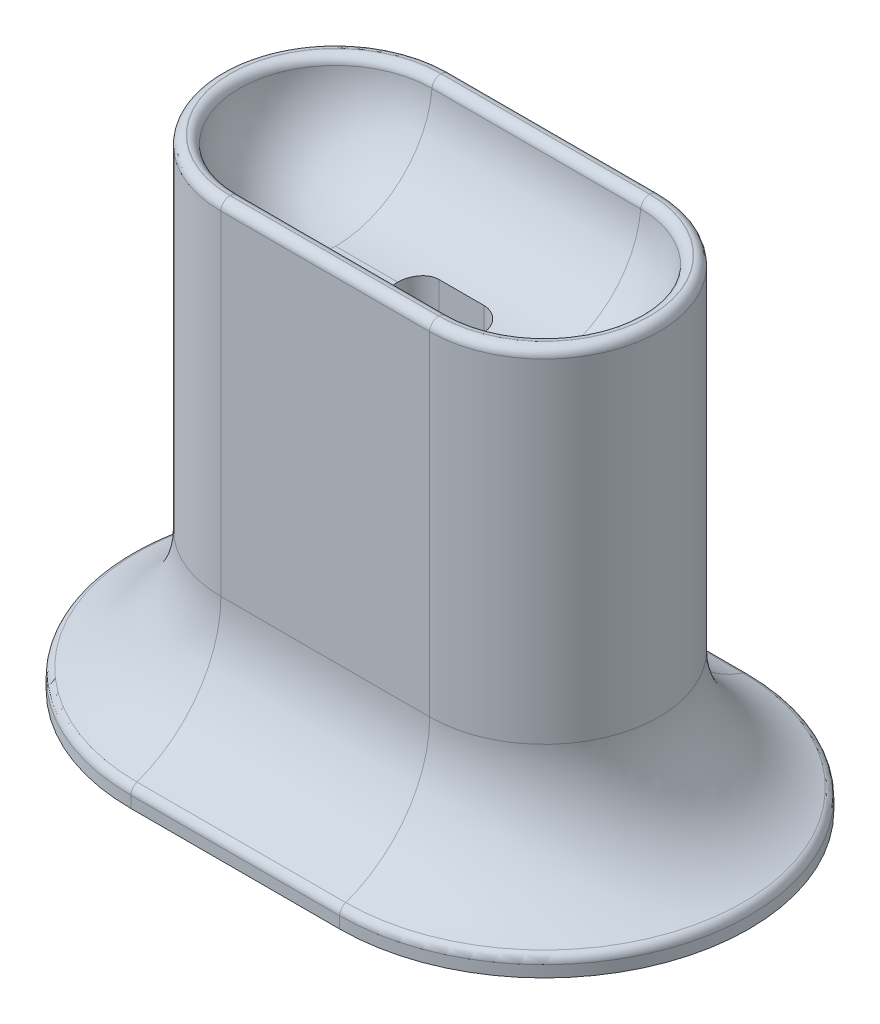
from build123d import *

# Parameters (mm, degrees)
BOSS_EXTRUDE1_DEPTH     = 53.5
BOSS_EXTRUDE2_START     = 32.75
BOSS_EXTRUDE2_DEPTH     = 10
BOSS_EXTRUDE3_DEPTH     = 2
FILLET1_R               = 10.75
FILLET2_R               = 14
FILLET3_R               = 1
CUT_EXTRUDE4_DEPTH      = 79.076260797
CUT_EXTRUDE5_DEPTH      = 61.840180017
CUT_EXTRUDE5_DEPTH_BACK = 61.840180017


# Some blends are built 0.0001 mm under size
with BuildPart() as part:
    # Sketch2 → Boss-Extrude1 (new body)
    with BuildSketch(Plane(origin=(0, 0, 0), x_dir=(1, 0, 0), z_dir=(0, 1, 0))):
        with BuildLine():
            Line((0, -12.75), (23.2, -12.75))
            ThreePointArc((23.2, -12.75), (35.95, 0), (23.2, 12.75))
            Line((23.2, 12.75), (0, 12.75))
            ThreePointArc((0, 12.75), (-12.75, 0), (0, -12.75))
        make_face()
        with BuildLine():
            ThreePointArc((23.2, -10.75), (33.95, 0), (23.2, 10.75))
            Line((23.2, 10.75), (0, 10.75))
            ThreePointArc((0, 10.75), (-10.75, 0), (0, -10.75))
            Line((0, -10.75), (23.2, -10.75))
        make_face(mode=Mode.SUBTRACT)
    extrude(amount=BOSS_EXTRUDE1_DEPTH)

    # Sketch2<3> → Boss-Extrude2 (add)
    with BuildSketch(Plane(origin=(0, 0, 0), x_dir=(1, 0, 0), z_dir=(0, 1, 0)).offset(BOSS_EXTRUDE2_START)):
        with BuildLine():
            Line((0, -10.75), (23.2, -10.75))
            ThreePointArc((23.2, -10.75), (33.95, 0), (23.2, 10.75))
            Line((23.2, 10.75), (0, 10.75))
            ThreePointArc((0, 10.75), (-10.75, 0), (0, -10.75))
        make_face()
    extrude(amount=BOSS_EXTRUDE2_DEPTH)

    # Sketch2<4> → Boss-Extrude3 (add)
    with BuildSketch(Plane(origin=(0, 0, 0), x_dir=(1, 0, 0), z_dir=(0, 1, 0))):
        with BuildLine():
            Line((0, 22.75), (23.2, 22.75))
            ThreePointArc((23.2, 22.75), (45.95, 0), (23.2, -22.75))
            Line((23.2, -22.75), (0, -22.75))
            ThreePointArc((0, -22.75), (-22.75, 0), (0, 22.75))
        make_face()
        with BuildLine():
            ThreePointArc((23.2, -12.75), (35.95, 0), (23.2, 12.75))
            Line((23.2, 12.75), (0, 12.75))
            ThreePointArc((0, 12.75), (-12.75, 0), (0, -12.75))
            Line((0, -12.75), (23.2, -12.75))
        make_face(mode=Mode.SUBTRACT)
    extrude(amount=BOSS_EXTRUDE3_DEPTH)

    # Fillet1
    fillet1_edges = [part.edges().sort_by_distance(p)[0] for p in [
        (11.6, 42.75, -10.75),
        (33.95, 42.75, 0),
        (11.6, 42.75, 10.75),
        (-10.75, 42.75, 0),
    ]]
    fillet(fillet1_edges, radius=FILLET1_R - 0.0001)  # a hair under: the kernel refuses the full size

    # Fillet2
    # the kernel refuses this fillet: 14 mm, written as the material it adds along each edge
    with BuildSketch(Plane(origin=(23.2, 2, 0), x_dir=(0, 0, 1), z_dir=(-1, 0, 0))) as fillet2_piece_1:
        with BuildLine():
            CenterArc((26.75, 13.416407865), FILLET2_R, 180, 73.398450401)
            Line((22.75, 0), (22.67, -0.268328157))
            ThreePointArc((22.67, -0.268328157), (17.75, -0.28), (12.75, -0.28))
            Line((12.75, -0.28), (12.47, 0))
            Line((12.47, 0), (12.47, 13.416407865))
            Line((12.47, 13.416407865), (12.75, 13.416407865))
        make_face()
    revolve(axis=Axis((23.2, 2, 0), (0, 1, 0)), revolution_arc=180)
    with BuildSketch(Plane(origin=(0, 2, 12.75), x_dir=(0, 1, 0), z_dir=(1, 0, 0)), Plane(origin=(23.2, 2, -12.75), x_dir=(0, 1, 0), z_dir=(-1, 0, 0))) as fillet2_piece_2:
        with BuildLine():
            CenterArc((13.416407865, 14), FILLET2_R, 196.601549599, 73.398450401)
            Line((0, 10), (-0.268328157, 9.92))
            ThreePointArc((-0.268328157, 9.92), (-0.28, 5), (-0.28, 0))
            Line((-0.28, 0), (0, -0.28))
            Line((0, -0.28), (13.416407865, -0.28))
            Line((13.416407865, -0.28), (13.416407865, 0))
        make_face()
    extrude(amount=23.2)
    with BuildSketch(Plane(origin=(0, 2, 0), x_dir=(0, 0, -1), z_dir=(1, 0, 0))) as fillet2_piece_3:
        with BuildLine():
            CenterArc((26.75, 13.416407865), FILLET2_R, 180, 73.398450401)
            Line((22.75, 0), (22.67, -0.268328157))
            ThreePointArc((22.67, -0.268328157), (17.75, -0.28), (12.75, -0.28))
            Line((12.75, -0.28), (12.47, 0))
            Line((12.47, 0), (12.47, 13.416407865))
            Line((12.47, 13.416407865), (12.75, 13.416407865))
        make_face()
    revolve(axis=Axis((0, 2, 0), (0, 1, 0)), revolution_arc=180)

    # Fillet3
    # the kernel refuses this fillet: 1 mm, written as the material it takes off along each edge
    with BuildSketch(Plane(origin=(0, 53.5, 10.75), x_dir=(0, 0, 1), z_dir=(1, 0, 0)), Plane(origin=(23.2, 53.5, -10.75), x_dir=(0, 0, -1), z_dir=(-1, 0, 0))) as fillet3_piece_1:
        with BuildLine():
            CenterArc((0.957377651, 1), FILLET3_R, 184.881694581, 85.118305419)
            Line((-0.038994884, 0.914901403), (-0.138632138, 0.906391544))
            ThreePointArc((-0.138632138, 0.906391544), (-0.1, 0.0001), (-0.1, 0))
            Line((-0.1, 0), (0, -0.1))
            Line((0, -0.1), (0.957377651, -0.1))
            Line((0.957377651, -0.1), (0.957377651, 0))
        make_face()
    extrude(amount=23.2, mode=Mode.SUBTRACT)
    with BuildSketch(Plane(origin=(0, 53.5, 0), x_dir=(0, 0, -1), z_dir=(1, 0, 0))) as fillet3_piece_2:
        with BuildLine():
            CenterArc((11.707377651, -1), FILLET3_R, 90, 85.118305419)
            Line((10.711005116, -0.914901403), (10.611367862, -0.906391544))
            ThreePointArc((10.611367862, -0.906391544), (10.65, -0.0001), (10.65, 0))
            Line((10.65, 0), (10.75, 0.1))
            Line((10.75, 0.1), (11.707377651, 0.1))
            Line((11.707377651, 0.1), (11.707377651, 0))
        make_face()
    revolve(axis=Axis((0, 53.5, 0), (0, 1, 0)), revolution_arc=180, mode=Mode.SUBTRACT)
    with BuildSketch(Plane(origin=(0, 53.5, 12.75), x_dir=(0, -1, 0), z_dir=(1, 0, 0))) as fillet3_piece_3:
        with BuildLine():
            CenterArc((FILLET3_R, FILLET3_R), FILLET3_R, 180, 90)
            Line((0, FILLET3_R), (0, 0))
            Line((0, 0), (FILLET3_R, 0))
        make_face()
    extrude(amount=23.2, mode=Mode.SUBTRACT)
    with BuildSketch(Plane(origin=(23.2, 53.5, 0), x_dir=(0, 0, 1), z_dir=(-1, 0, 0))) as fillet3_piece_4:
        with BuildLine():
            CenterArc((12.75 - FILLET3_R, -FILLET3_R), FILLET3_R, 0, 90)
            Line((12.75, -FILLET3_R), (12.75, 0))
            Line((12.75, 0), (12.75 - FILLET3_R, 0))
        make_face()
    revolve(axis=Axis((23.2, 53.5, 0), (0, 1, 0)), revolution_arc=180, mode=Mode.SUBTRACT)
    with BuildSketch(Plane(origin=(23.2, 53.5, -12.75), x_dir=(0, 0, 1), z_dir=(-1, 0, 0))) as fillet3_piece_5:
        with BuildLine():
            CenterArc((FILLET3_R, -FILLET3_R), FILLET3_R, 90, 90)
            Line((0, -FILLET3_R), (0, 0))
            Line((0, 0), (FILLET3_R, 0))
        make_face()
    extrude(amount=23.2, mode=Mode.SUBTRACT)
    with BuildSketch(Plane(origin=(0, 53.5, 0), x_dir=(0, 0, -1), z_dir=(1, 0, 0))) as fillet3_piece_6:
        with BuildLine():
            CenterArc((12.75 - FILLET3_R, -FILLET3_R), FILLET3_R, 0, 90)
            Line((12.75 - FILLET3_R, 0), (12.75, 0))
            Line((12.75, 0), (12.75, -FILLET3_R))
        make_face()
    revolve(axis=Axis((0, 53.5, 0), (0, 1, 0)), revolution_arc=180, mode=Mode.SUBTRACT)
    with BuildSketch(Plane(origin=(0, 2, -22.75), x_dir=(0, 0.30962089103713925, 0.9508600863604318), z_dir=(1, 0, 0)), Plane(origin=(23.2, 2, 22.75), x_dir=(0, 0.30962089103713925, -0.9508600863604318), z_dir=(-1, 0, 0))) as fillet3_piece_7:
        with BuildLine():
            CenterArc((0.726159611, 0.99968645), FILLET3_R, 198.036385117, 70.528779366)
            Line((-0.224700475, 0.690065559), (0, 0))
            ThreePointArc((0, 0), (0.350559812, 0.004389695), (0.701119624, 0))
        make_face()
    extrude(amount=23.2, mode=Mode.SUBTRACT)
    with BuildSketch(Plane(origin=(0, 2, 0), x_dir=(0, 0, 1), z_dir=(1, 0, 0))) as fillet3_piece_8:
        with BuildLine():
            CenterArc((21.75, 0.725727759), FILLET3_R, 289.471220634, 70.528779366)
            Line((22.75, 0.725727759), (22.75, 0))
            ThreePointArc((22.75, 0), (22.415307525, -0.104366656), (22.083333333, -0.217081283))
        make_face()
    revolve(axis=Axis((0, 2, 0), (0, -1, 0)), revolution_arc=180, mode=Mode.SUBTRACT)
    with BuildSketch(Plane(origin=(23.2, 2, 0), x_dir=(0, 0, -1), z_dir=(-1, 0, 0))) as fillet3_piece_9:
        with BuildLine():
            CenterArc((21.75, 0.725727759), FILLET3_R, 289.471220634, 70.528779366)
            Line((22.75, 0.725727759), (22.75, 0))
            ThreePointArc((22.75, 0), (22.415307525, -0.104366656), (22.083333333, -0.217081283))
        make_face()
    revolve(axis=Axis((23.2, 2, 0), (0, -1, 0)), revolution_arc=180, mode=Mode.SUBTRACT)
    with BuildSketch(Plane(origin=(23.2, 53.5, 0), x_dir=(0, 0, 1), z_dir=(-1, 0, 0))) as fillet3_piece_10:
        with BuildLine():
            CenterArc((11.707377651, -1), FILLET3_R, 90, 85.118305419)
            Line((10.711005116, -0.914901403), (10.611367862, -0.906391544))
            ThreePointArc((10.611367862, -0.906391544), (10.65, -0.0001), (10.65, 0))
            Line((10.65, 0), (10.75, 0.1))
            Line((10.75, 0.1), (11.707377651, 0.1))
            Line((11.707377651, 0.1), (11.707377651, 0))
        make_face()
    revolve(axis=Axis((23.2, 53.5, 0), (0, 1, 0)), revolution_arc=180, mode=Mode.SUBTRACT)

    # Sketch4 → Cut-Extrude4 (cut, through all)
    with BuildSketch(Plane.XY.offset(-10.75)):
        with BuildLine():
            Line((13.6, 0), (9.6, 0))
            Line((9.6, 0), (9.6, 1.331324862))
            ThreePointArc((9.6, 1.331324862), (11.6, 5.331324862), (13.6, 1.331324862))
            Line((13.6, 1.331324862), (13.6, 0))
        make_face()
    extrude(amount=-CUT_EXTRUDE4_DEPTH, mode=Mode.SUBTRACT)

    # Sketch3 → Cut-Extrude5 (cut, two sides: drawn at the far end of the back side and taken through both)
    with BuildSketch(Plane.XZ.offset(-32.75).offset(-CUT_EXTRUDE5_DEPTH_BACK)):
        with BuildLine():
            Line((9.2, 2.3), (14.2, 2.3))
            ThreePointArc((14.2, 2.3), (16.5, 0), (14.2, -2.3))
            Line((14.2, -2.3), (9.2, -2.3))
            ThreePointArc((9.2, -2.3), (6.9, 0), (9.2, 2.3))
        make_face()
    extrude(amount=CUT_EXTRUDE5_DEPTH + CUT_EXTRUDE5_DEPTH_BACK, mode=Mode.SUBTRACT)


solid = part.part
